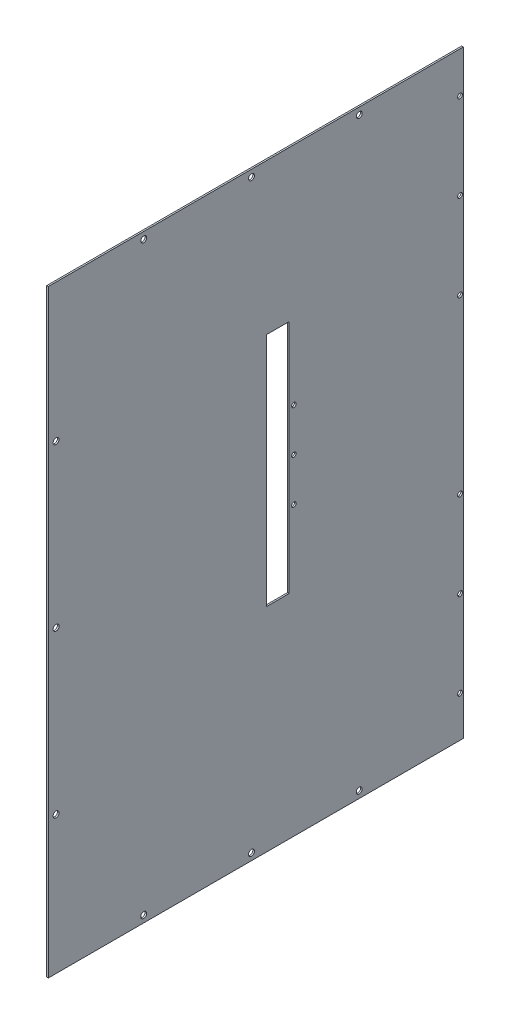
from build123d import *

# Parameters (mm, degrees)
SKETCH_1_W             = 1.5
SKETCH_1_H             = 555.7
SM_BASE_FLANGE_1_DEPTH = 385
SKETCH_6_W             = 88.363212941
SKETCH_6_H             = 264.50252719
CUT_EXTRUDE_1_DEPTH    = 74.5
SKETCH_7_W             = 1.5
SKETCH_7_H             = 264.50252719
EXTRUDE_1_DEPTH        = 47.7
SKETCH_8_W             = 1.5
SKETCH_8_H             = 40.663212941
EXTRUDE_2_DEPTH        = 20
SKETCH_9_W             = 1.5
SKETCH_9_H             = 40.663212941
EXTRUDE_3_DEPTH        = 26
SKETCH_10_W            = 1.5
SKETCH_10_H            = 218.50252719
EXTRUDE_4_DEPTH        = 20
SKETCH_12_R            = 2.75
CUT_EXTRUDE_2_DEPTH    = 20
SKETCH_13_R            = 2.75
CUT_EXTRUDE_3_DEPTH    = 10
SKETCH_14_R            = 2.75
CUT_EXTRUDE_4_DEPTH    = 10
SKETCH_15_R            = 2.25
CUT_EXTRUDE_5_DEPTH    = 10
SKETCH_17_R            = 2.1
CUT_EXTRUDE_6_DEPTH    = 20


# Sheet-metal steps are written as plain solids
with BuildPart() as part:
    # Sketch 1 → 基体-法兰1 (new body)
    with BuildSketch(Plane.XY):
        with Locations((0.75, 277.85)):
            Rectangle(SKETCH_1_W, SKETCH_1_H)
    extrude(amount=SM_BASE_FLANGE_1_DEPTH)

    # 草图6 → 切除-拉伸1 (cut)
    with BuildSketch(Plane.ZY):
        with Locations((158.262985354, 303.520646834)):
            Rectangle(SKETCH_6_W, SKETCH_6_H)
    extrude(amount=-CUT_EXTRUDE_1_DEPTH, mode=Mode.SUBTRACT)

    # 草图7 → 凸台-拉伸1 (add)
    with BuildSketch(Plane.XY.offset(114.081378883)):
        with Locations((0.75, 303.520646834)):
            Rectangle(SKETCH_7_W, SKETCH_7_H)
    extrude(amount=EXTRUDE_1_DEPTH)

    # 草图8 → 凸台-拉伸2 (add)
    with BuildSketch(Plane.XZ.offset(-435.771910429)):
        with Locations((0.75, 182.112985353)):
            Rectangle(SKETCH_8_W, SKETCH_8_H)
    extrude(amount=EXTRUDE_2_DEPTH)

    # 草图9 → 凸台-拉伸3 (add)
    with BuildSketch(Plane(origin=(0, 171.269383239, 0), x_dir=(1, 0, 0), z_dir=(0, 1, 0))):
        with Locations((0.75, -182.112985353)):
            Rectangle(SKETCH_9_W, SKETCH_9_H)
    extrude(amount=EXTRUDE_3_DEPTH)

    # 草图10 → 凸台-拉伸4 (add)
    with BuildSketch(Plane(origin=(0, 0, 202.444591824), x_dir=(-1, 0, 0), z_dir=(0, 0, -1))):
        with Locations((-0.75, 306.520646834)):
            Rectangle(SKETCH_10_W, SKETCH_10_H)
    extrude(amount=EXTRUDE_4_DEPTH)

    # 草图12 → 切除-拉伸2 (cut)
    with BuildSketch(Plane(origin=(1.5, 0, 0), x_dir=(0, 0, -1), z_dir=(1, 0, 0))):
        with Locations((-296.5, 6.3817)):
            Circle(SKETCH_12_R)
        with Locations((-196.5, 6.3817)):
            Circle(SKETCH_12_R)
        with Locations((-96.5, 6.3817)):
            Circle(SKETCH_12_R)
    extrude(amount=-CUT_EXTRUDE_2_DEPTH, mode=Mode.SUBTRACT)

    # 草图13 → 切除-拉伸3 (cut)
    with BuildSketch(Plane(origin=(1.5, 0, 0), x_dir=(0, 0, -1), z_dir=(1, 0, 0))):
        with Locations((-377.815462169, 127.8484)):
            Circle(SKETCH_13_R)
        with Locations((-377.815462169, 277.8484)):
            Circle(SKETCH_13_R)
        with Locations((-377.815462169, 427.8484)):
            Circle(SKETCH_13_R)
    extrude(amount=-CUT_EXTRUDE_3_DEPTH, mode=Mode.SUBTRACT)

    # 草图14 → 切除-拉伸4 (cut)
    with BuildSketch(Plane(origin=(1.5, 0, 0), x_dir=(0, 0, -1), z_dir=(1, 0, 0))):
        with Locations((-296.5, 549.3183)):
            Circle(SKETCH_14_R)
        with Locations((-196.5, 549.3183)):
            Circle(SKETCH_14_R)
        with Locations((-96.5, 549.3183)):
            Circle(SKETCH_14_R)
    extrude(amount=-CUT_EXTRUDE_4_DEPTH, mode=Mode.SUBTRACT)

    # 草图15 → 切除-拉伸5 (cut)
    with BuildSketch(Plane.ZY):
        with Locations((3, 517.85)):
            Circle(SKETCH_15_R)
        with Locations((3, 437.85)):
            Circle(SKETCH_15_R)
        with Locations((3, 357.85)):
            Circle(SKETCH_15_R)
        with Locations((3, 37.85)):
            Circle(SKETCH_15_R)
        with Locations((3, 117.85)):
            Circle(SKETCH_15_R)
        with Locations((3, 197.85)):
            Circle(SKETCH_15_R)
    extrude(amount=-CUT_EXTRUDE_5_DEPTH, mode=Mode.SUBTRACT)

    # 草图17 → 切除-拉伸6 (cut)
    with BuildSketch(Plane(origin=(1.5, 0, 0), x_dir=(0, 0, -1), z_dir=(1, 0, 0))):
        with Locations((-157.14323819, 266.5334)):
            Circle(SKETCH_17_R)
        with Locations((-157.14323819, 306.5334)):
            Circle(SKETCH_17_R)
        with Locations((-157.14323819, 346.5334)):
            Circle(SKETCH_17_R)
    extrude(amount=-CUT_EXTRUDE_6_DEPTH, mode=Mode.SUBTRACT)


solid = part.part
